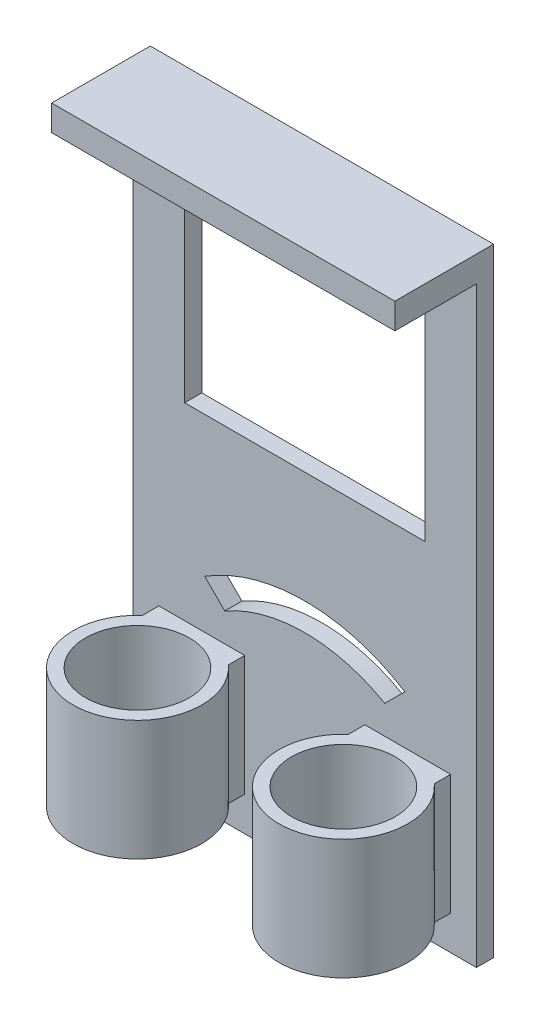
from build123d import *
from build123d.topology import SkipClean

# Parameters (mm, degrees)
SKETCH1_W                                    = 40
SKETCH1_H                                    = 40
BOSS_EXTRUDE2_DEPTH                          = 2
SKETCH2_W                                    = 6
SKETCH2_H                                    = 4
BOSS_EXTRUDE5_DEPTH                          = 3
SKETCH4_R                                    = 3.5
SKETCH4_R_2                                  = 1.6
BOSS_EXTRUDE6_DEPTH                          = 4
MIRROR2_AT_THE_SECOND_PLANE_COPY_1_SKETC_W   = 6
MIRROR2_AT_THE_SECOND_PLANE_COPY_1_SKETC_H   = 4
MIRROR2_AT_THE_SECOND_PLANE_COPY_1_DEPTH     = 3
MIRROR2_AT_THE_SECOND_PLANE_COPY_2_SKETC_R   = 3.5
MIRROR2_AT_THE_SECOND_PLANE_COPY_2_SKETC_R_2 = 1.6
MIRROR2_AT_THE_SECOND_PLANE_COPY_2_DEPTH     = 4
CUT_EXTRUDE2_DEPTH                           = 2
SKETCH8_R                                    = 1.6
CUT_EXTRUDE3_DEPTH                           = 2
SKETCH18_W                                   = 6
SKETCH18_H                                   = 2
BOSS_EXTRUDE10_DEPTH                         = 32
BOSS_EXTRUDE11_DEPTH                         = 3
SKETCH20_R                                   = 1.6
BOSS_EXTRUDE12_DEPTH                         = 10
SKETCH22_R                                   = 1.6
CUT_EXTRUDE4_DEPTH                           = 7
SKETCH23_R                                   = 6.05
BOSS_EXTRUDE14_DEPTH                         = 14
SKETCH21_R                                   = 1.6
CUT_EXTRUDE5_DEPTH                           = 10
CUT_EXTRUDE7_DEPTH                           = 22
CUT_EXTRUDE9_DEPTH                           = 2
BOSS_EXTRUDE19_START                         = 2
SKETCH32_R                                   = 3.5
BOSS_EXTRUDE19_DEPTH                         = 2
SKETCH33_W                                   = 40
SKETCH33_H                                   = 3
BOSS_EXTRUDE20_DEPTH                         = 8


with BuildPart() as part:
    # Sketch1 → Boss-Extrude2 (new body)
    with BuildSketch(Plane.XY):
        Rectangle(SKETCH1_W, SKETCH1_H)
    extrude(amount=BOSS_EXTRUDE2_DEPTH)

    # Sketch2 → Boss-Extrude5 (add)
    with BuildSketch(Plane.XY.offset(2)):
        with Locations((-12, 10)):
            Rectangle(SKETCH2_W, SKETCH2_H)
    boss_extrude5 = extrude(amount=BOSS_EXTRUDE5_DEPTH)

    # Sketch4 → Boss-Extrude6 (add)
    with BuildSketch(Plane(origin=(0, 12, 0), x_dir=(1, 0, 0), z_dir=(0, 1, 0))):
        with Locations((-12, -6.6)):
            Circle(SKETCH4_R)
        with Locations((-12, -6.6)):
            Circle(SKETCH4_R_2, mode=Mode.SUBTRACT)
    boss_extrude6 = extrude(amount=-BOSS_EXTRUDE6_DEPTH)

    # Mirror2: Boss-Extrude5, Boss-Extrude6 across plane
    add(boss_extrude5.mirror(Plane(origin=(0, 0, 0), x_dir=(0, 0, 1), z_dir=(1, 0, 0))))
    add(boss_extrude6.mirror(Plane(origin=(0, 0, 0), x_dir=(0, 0, 1), z_dir=(1, 0, 0))))

    # Mirror2 at the second plane: Boss-Extrude5, Boss-Extrude6 across plane
    add(boss_extrude5.mirror(Plane(origin=(0, 3, 0), x_dir=(0, 0, 1), z_dir=(0, -1, 0))))
    add(boss_extrude6.mirror(Plane(origin=(0, 3, 0), x_dir=(0, 0, 1), z_dir=(0, -1, 0))))

    # Mirror2 at the second plane copy 1 sketc → Mirror2 at the second plane copy 1 (add)
    with BuildSketch(Plane(origin=(0, 6, 2), x_dir=(-1, 0, 0), z_dir=(0, 0, 1))):
        with Locations((-12, 10)):
            Rectangle(MIRROR2_AT_THE_SECOND_PLANE_COPY_1_SKETC_W, MIRROR2_AT_THE_SECOND_PLANE_COPY_1_SKETC_H)
    extrude(amount=MIRROR2_AT_THE_SECOND_PLANE_COPY_1_DEPTH)

    # Mirror2 at the second plane copy 2 sketc → Mirror2 at the second plane copy 2 (add)
    with BuildSketch(Plane(origin=(0, -6, 0), x_dir=(-1, 0, 0), z_dir=(0, -1, 0))):
        with Locations((-12, -6.6)):
            Circle(MIRROR2_AT_THE_SECOND_PLANE_COPY_2_SKETC_R)
        with Locations((-12, -6.6)):
            Circle(MIRROR2_AT_THE_SECOND_PLANE_COPY_2_SKETC_R_2, mode=Mode.SUBTRACT)
    extrude(amount=-MIRROR2_AT_THE_SECOND_PLANE_COPY_2_DEPTH)

    # Sketch7 → Cut-Extrude2 (cut)
    with BuildSketch(Plane.XY.offset(2)):
        with BuildLine():
            ThreePointArc((-9.324585763, 1.324585763), (0, 3.8), (9.324585763, 1.324585763))
            Line((9.324585763, 1.324585763), (11.657506391, 3.657506391))
            ThreePointArc((11.657506391, 3.657506391), (0, 7), (-11.657506391, 3.657506391))
            Line((-11.657506391, 3.657506391), (-9.324585763, 1.324585763))
        make_face()
    extrude(amount=-CUT_EXTRUDE2_DEPTH, mode=Mode.SUBTRACT)

    # Sketch8 → Cut-Extrude3 (cut)
    with BuildSketch(Plane(origin=(0, 0, 0), x_dir=(-1, 0, 0), z_dir=(0, 0, -1))):
        with Locations((0, -10)):
            Circle(SKETCH8_R)
    extrude(amount=-CUT_EXTRUDE3_DEPTH, mode=Mode.SUBTRACT)

    # Sketch18 → Boss-Extrude10 (add)
    with BuildSketch(Plane(origin=(0, 20, 0), x_dir=(1, 0, 0), z_dir=(0, 1, 0))):
        with Locations((-17, -1)):
            Rectangle(SKETCH18_W, SKETCH18_H)
        with Locations((17, -1)):
            Rectangle(SKETCH18_W, SKETCH18_H)
    extrude(amount=BOSS_EXTRUDE10_DEPTH)

    # Sketch19 → Boss-Extrude11 (add)
    with BuildSketch(Plane(origin=(0, 52, 0), x_dir=(1, 0, 0), z_dir=(0, 1, 0))):
        Polygon((-14, 0), (-20, 0), (-20, -2), (-20, -3.5), (20, -3.5), (20, 0), align=None)
    extrude(amount=-BOSS_EXTRUDE11_DEPTH)

    # Sketch20 → Boss-Extrude12 (add)
    # profile 1 of 2: a face of its own
    with SkipClean():  # the faces are left unmerged after this step: merging them gives an invalid solid
        with BuildSketch(Plane.XZ.offset(6)):
            with BuildLine():
                Line((-9, 2), (-9, 4.797224362))
                ThreePointArc((-9, 4.797224362), (-12, 10.1), (-15, 4.797224362))
                Line((-15, 4.797224362), (-15, 2))
                Line((-15, 2), (-9, 2))
            make_face()
            with Locations((-12, 6.6)):
                Circle(SKETCH20_R, mode=Mode.SUBTRACT)
        # profile 2 of 2: a face of its own
        with BuildSketch(Plane.XZ.offset(6)):
            with BuildLine():
                Line((9, 4.797224362), (9, 2))
                Line((9, 2), (15, 2))
                Line((15, 2), (15, 4.797224362))
                ThreePointArc((15, 4.797224362), (12, 10.1), (9, 4.797224362))
            make_face()
            with Locations((12, 6.6)):
                Circle(SKETCH20_R, mode=Mode.SUBTRACT)
        extrude(amount=BOSS_EXTRUDE12_DEPTH)

    # Sketch22 → Cut-Extrude4 (cut)
    # profile 1 of 2: a face of its own
    with BuildSketch(Plane(origin=(0, -2, 0), x_dir=(1, 0, 0), z_dir=(0, 1, 0))):
        with BuildLine():
            Line((9, -2), (9, -4.797224362))
            ThreePointArc((9, -4.797224362), (12, -10.1), (15, -4.797224362))
            Line((15, -4.797224362), (15, -2))
            Line((15, -2), (9, -2))
        make_face()
        with Locations((12, -6.6)):
            Circle(SKETCH22_R, mode=Mode.SUBTRACT)
    # profile 2 of 2: a face of its own
    with BuildSketch(Plane(origin=(0, -2, 0), x_dir=(1, 0, 0), z_dir=(0, 1, 0))):
        with BuildLine():
            Line((-9, -4.797224362), (-9, -2))
            Line((-9, -2), (-15, -2))
            Line((-15, -2), (-15, -4.797224362))
            ThreePointArc((-15, -4.797224362), (-12, -10.1), (-9, -4.797224362))
        make_face()
        with Locations((-12, -6.6)):
            Circle(SKETCH22_R, mode=Mode.SUBTRACT)
    extrude(amount=-CUT_EXTRUDE4_DEPTH, mode=Mode.SUBTRACT)

    # Sketch23 → Boss-Extrude14 (add)
    # profile 1 of 2: a face of its own
    with BuildSketch(Plane.XZ.offset(16)):
        with BuildLine():
            Line((-7, 2), (-7, 3.909830056))
            ThreePointArc((-7, 3.909830056), (-12, 17), (-17, 3.909830056))
            Line((-17, 3.909830056), (-17, 2))
            Line((-17, 2), (-7, 2))
        make_face()
        with Locations((-12, 9.5)):
            Circle(SKETCH23_R, mode=Mode.SUBTRACT)
    # profile 2 of 2: a face of its own
    with BuildSketch(Plane.XZ.offset(16)):
        with BuildLine():
            Line((7, 2), (17, 2))
            Line((17, 2), (17, 3.909830056))
            ThreePointArc((17, 3.909830056), (12, 17), (7, 3.909830056))
            Line((7, 3.909830056), (7, 2))
        make_face()
        with Locations((12, 9.5)):
            Circle(SKETCH23_R, mode=Mode.SUBTRACT)
    extrude(amount=-BOSS_EXTRUDE14_DEPTH)

    # Sketch21 → Cut-Extrude5 (cut)
    # profile 1 of 2: a face of its own
    with BuildSketch(Plane(origin=(0, 12, 0), x_dir=(1, 0, 0), z_dir=(0, 1, 0))):
        with BuildLine():
            Line((9, -2), (9, -4.797224362))
            ThreePointArc((9, -4.797224362), (12, -10.1), (15, -4.797224362))
            Line((15, -4.797224362), (15, -2))
            Line((15, -2), (9, -2))
        make_face()
        with Locations((12, -6.6)):
            Circle(SKETCH21_R, mode=Mode.SUBTRACT)
    # profile 2 of 2: a face of its own
    with BuildSketch(Plane(origin=(0, 12, 0), x_dir=(1, 0, 0), z_dir=(0, 1, 0))):
        with BuildLine():
            Line((-9, -4.797224362), (-9, -2))
            Line((-9, -2), (-15, -2))
            Line((-15, -2), (-15, -4.797224362))
            ThreePointArc((-15, -4.797224362), (-12, -10.1), (-9, -4.797224362))
        make_face()
        with Locations((-12, -6.6)):
            Circle(SKETCH21_R, mode=Mode.SUBTRACT)
    extrude(amount=-CUT_EXTRUDE5_DEPTH, mode=Mode.SUBTRACT)

    # Sketch24 → Cut-Extrude7 (cut)
    with BuildSketch(Plane(origin=(0, -9, 0), x_dir=(1, 0, 0), z_dir=(0, 1, 0))):
        with BuildLine():
            Line((9, -4.246191857), (9, -4.797224362))
            ThreePointArc((9, -4.797224362), (12, -10.1), (15, -4.797224362))
            Line((15, -4.797224362), (15, -4.246191857))
            ThreePointArc((15, -4.246191857), (12, -3.45), (9, -4.246191857))
        make_face()
        with BuildLine():
            Line((-9, -4.797224362), (-9, -4.246191857))
            ThreePointArc((-9, -4.246191857), (-12, -3.45), (-15, -4.246191857))
            Line((-15, -4.246191857), (-15, -4.797224362))
            ThreePointArc((-15, -4.797224362), (-12, -10.1), (-9, -4.797224362))
        make_face()
    extrude(amount=-CUT_EXTRUDE7_DEPTH, mode=Mode.SUBTRACT)

    # Sketch25 → Cut-Extrude9 (cut)
    with BuildSketch(Plane.XZ.offset(16)):
        with BuildLine():
            Line((-17, 2), (-7, 2))
            Line((-7, 2), (-7, 3.909830056))
            ThreePointArc((-7, 3.909830056), (-12, 17), (-17, 3.909830056))
            Line((-17, 3.909830056), (-17, 2))
        make_face()
        with BuildLine():
            Line((7, 3.909830056), (7, 2))
            Line((7, 2), (17, 2))
            Line((17, 2), (17, 3.909830056))
            ThreePointArc((17, 3.909830056), (12, 17), (7, 3.909830056))
        make_face()
    extrude(amount=-CUT_EXTRUDE9_DEPTH, mode=Mode.SUBTRACT)

    # Sketch32 → Boss-Extrude19 (add)
    # profile 1 of 2: a face of its own
    with BuildSketch(Plane.XZ.offset(14).offset(BOSS_EXTRUDE19_START)):
        with BuildLine():
            Line((7, 3.909830056), (7, 2))
            Line((7, 2), (17, 2))
            Line((17, 2), (17, 3.909830056))
            ThreePointArc((17, 3.909830056), (12, 17), (7, 3.909830056))
        make_face()
        with Locations((12, 9.5)):
            Circle(SKETCH32_R, mode=Mode.SUBTRACT)
    # profile 2 of 2: a face of its own
    with BuildSketch(Plane.XZ.offset(14).offset(BOSS_EXTRUDE19_START)):
        with BuildLine():
            Line((-17, 3.909830056), (-17, 2))
            Line((-17, 2), (-7, 2))
            Line((-7, 2), (-7, 3.909830056))
            ThreePointArc((-7, 3.909830056), (-12, 17), (-17, 3.909830056))
        make_face()
        with Locations((-12, 9.5)):
            Circle(SKETCH32_R, mode=Mode.SUBTRACT)
    extrude(amount=-BOSS_EXTRUDE19_DEPTH)

    # Sketch33 → Boss-Extrude20 (add)
    with BuildSketch(Plane.XY.offset(3.5)):
        with Locations((0, 50.5)):
            Rectangle(SKETCH33_W, SKETCH33_H)
    extrude(amount=BOSS_EXTRUDE20_DEPTH)


solid = part.part
